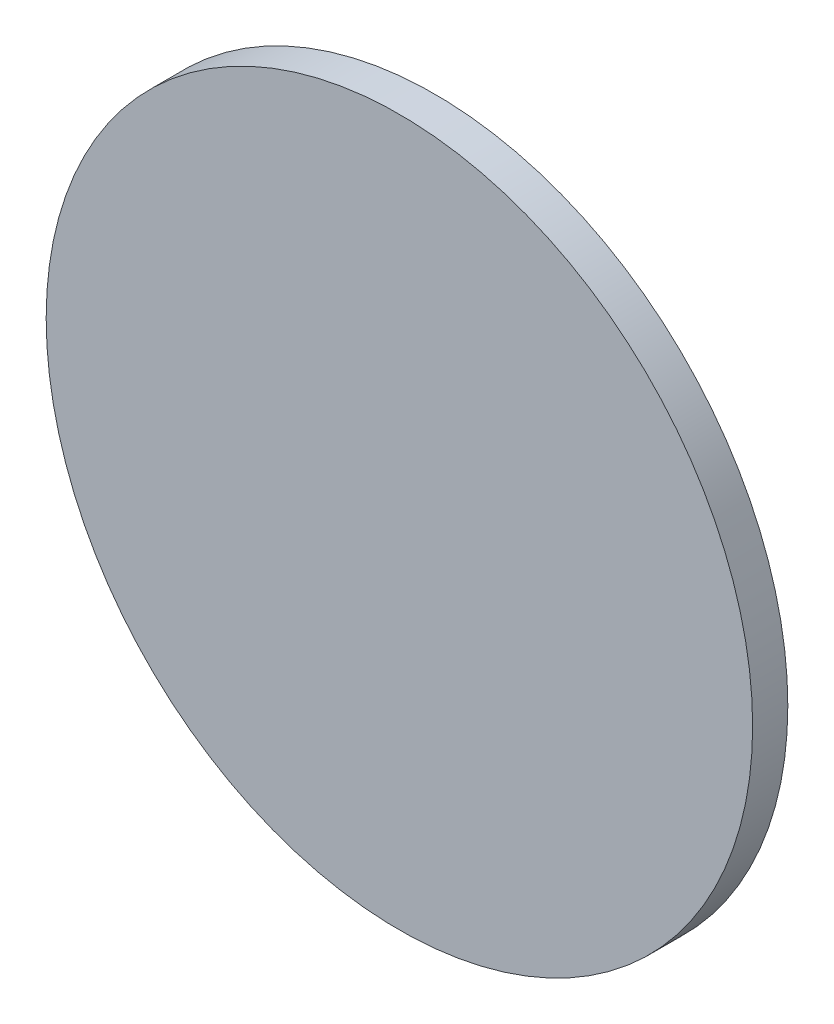
from build123d import *

# Parameters (mm, degrees)
SKETCH1_R           = 63.76
BOSS_EXTRUDE1_DEPTH = 6.35
SKETCH4_W           = 24.8
SKETCH4_H           = 45.33
CUT_EXTRUDE1_DEPTH  = 5
FILLET1_R           = 6.35


with BuildPart() as part:
    # Sketch1 → Boss-Extrude1 (new body)
    with BuildSketch(Plane.XY):
        Circle(SKETCH1_R)
    extrude(amount=BOSS_EXTRUDE1_DEPTH)

    # Sketch4 → Cut-Extrude1 (cut)
    with BuildSketch(Plane(origin=(0, 0, 0), x_dir=(-1, 0, 0), z_dir=(0, 0, -1))):
        with Locations((0, 10.245)):
            Rectangle(SKETCH4_W, SKETCH4_H)
    extrude(amount=-CUT_EXTRUDE1_DEPTH, mode=Mode.SUBTRACT)

    # Fillet1
    fillet1_edges = [part.edges().sort_by_distance(p)[0] for p in [
        (12.4, 32.91, 2.5),
        (-12.4, 32.91, 2.5),
        (12.4, -12.42, 2.5),
        (-12.4, -12.42, 2.5),
    ]]
    fillet(fillet1_edges, radius=FILLET1_R)


solid = part.part
